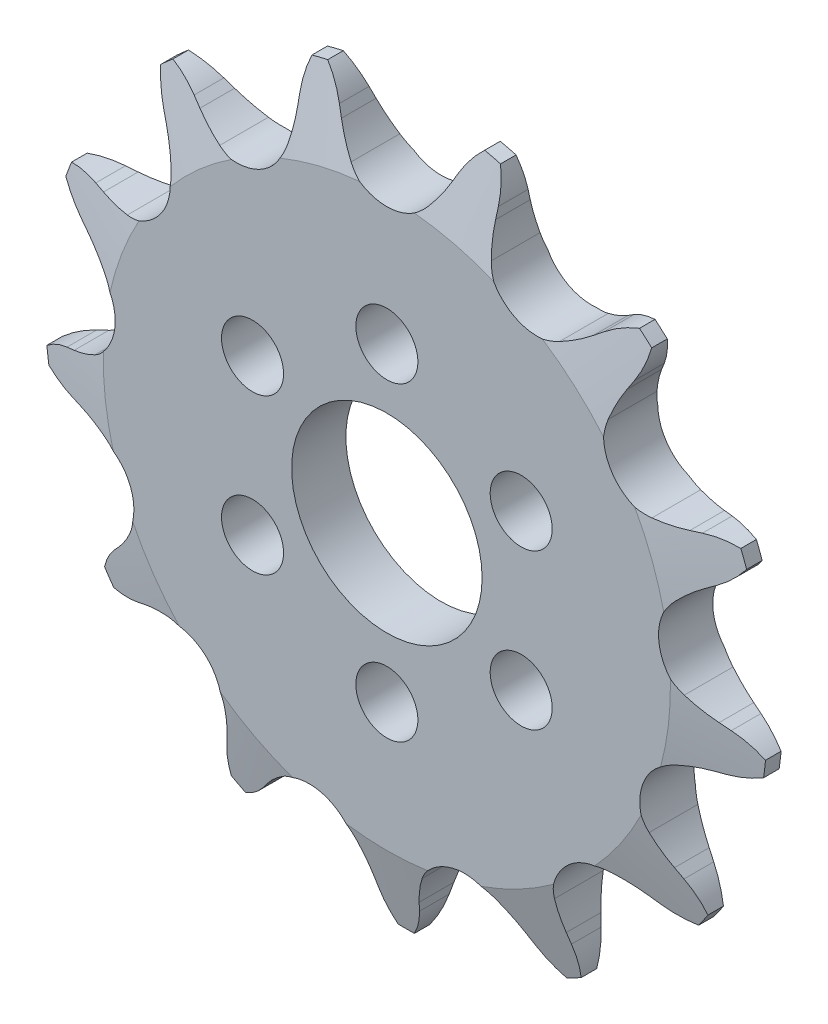
from build123d import *

# Parameters (mm, degrees)
CUT_EXTRUDE1_DEPTH      = 53.351870728
CIRPATTERN1_COUNT       = 13
CUT_EXTRUDE2_DEPTH      = 53.225813528
CUT_EXTRUDE2_DEPTH_BACK = 53.225813528
SKETCH3_OUTSIDE_W       = 96.34
SKETCH3_OUTSIDE_H       = 95.814
SKETCH3_OUTSIDE_R       = 36.957
SKETCH3_OUTSIDE_R_2     = 9.75
SKETCH4_R               = 3.175
CUT_EXTRUDE3_DEPTH      = 53.434548787


with BuildPart() as part:
    # Sketch1 → Revolve1 (revolve)
    with BuildSketch(Plane(origin=(0, 0, 0), x_dir=(0, 0, -1), z_dir=(1, 0, 0))):
        Polygon((2.778125, 0), (-2.778125, 0), (-2.778125, 29.028703417), (-0.79375, 36.966203417), (0.79375, 36.966203417), (2.778125, 29.028703417), align=None)
    revolve(axis=Axis((0, 0, -2.778125), (0, 0, 1)))

    # Sketch0 → Cut-Extrude1 (cut, symmetric)
    with BuildSketch(Plane.XY):
        with BuildLine():
            Line((13.954470356, -31.067878996), (13.281475664, -30.259243053))
            ThreePointArc((13.281475664, -30.259243053), (12.198620666, -29.105809316), (10.985992947, -28.089680215))
            ThreePointArc((10.985992947, -28.089680215), (6.712108073, -27.232092935), (3.326311638, -29.977622096))
            ThreePointArc((3.326311638, -29.977622096), (2.724801857, -31.440895931), (2.302008759, -32.965438593))
            Line((2.302008759, -32.965438593), (2.081893414, -33.99420639))
            ThreePointArc((2.081893414, -33.99420639), (-1.570781615, -39.344985469), (-7.926123198, -40.602962015))
            ThreePointArc((-7.926123198, -40.602962015), (9.900335889, -40.167241661), (25.887370848, -32.268684261))
            ThreePointArc((25.887370848, -32.268684261), (19.675384497, -34.108275848), (13.954470356, -31.067878996))
        make_face()
    cut_extrude1 = extrude(amount=CUT_EXTRUDE1_DEPTH, both=True, mode=Mode.SUBTRACT)

    # CirPattern1: Cut-Extrude1 ×13 about axis
    cirpattern1_axis = Axis((0, 0, -2.778125), (0, 0, -1))
    for i in range(1, CIRPATTERN1_COUNT):
        add(cut_extrude1.rotate(cirpattern1_axis, i * 360 / CIRPATTERN1_COUNT), mode=Mode.SUBTRACT)

    # Sketch3 outside → Cut-Extrude2 (cut, two sides: drawn at the far end of the back side and taken through both)
    # profile 1 of 2: a face of its own
    with BuildSketch(Plane.XY.offset(-CUT_EXTRUDE2_DEPTH_BACK)):
        with Locations((0, -0.442)):
            Rectangle(SKETCH3_OUTSIDE_W, SKETCH3_OUTSIDE_H)
        Circle(SKETCH3_OUTSIDE_R, mode=Mode.SUBTRACT)
    # profile 2 of 2: a face of its own
    with BuildSketch(Plane.XY.offset(-CUT_EXTRUDE2_DEPTH_BACK)):
        Circle(SKETCH3_OUTSIDE_R_2)
    extrude(amount=CUT_EXTRUDE2_DEPTH + CUT_EXTRUDE2_DEPTH_BACK, mode=Mode.SUBTRACT)

    # Sketch4 → Cut-Extrude3 (cut, through all)
    with BuildSketch(Plane(origin=(0, 0, -2.778125), x_dir=(-1, 0, 0), z_dir=(0, 0, -1))):
        with Locations((0, 15.875)):
            Circle(SKETCH4_R)
        with Locations((13.748153285, 7.9375)):
            Circle(SKETCH4_R)
        with Locations((13.748153285, -7.9375)):
            Circle(SKETCH4_R)
        with Locations((0, -15.875)):
            Circle(SKETCH4_R)
        with Locations((-13.748153285, -7.9375)):
            Circle(SKETCH4_R)
        with Locations((-13.748153285, 7.9375)):
            Circle(SKETCH4_R)
    extrude(amount=-CUT_EXTRUDE3_DEPTH, mode=Mode.SUBTRACT)


solid = part.part
